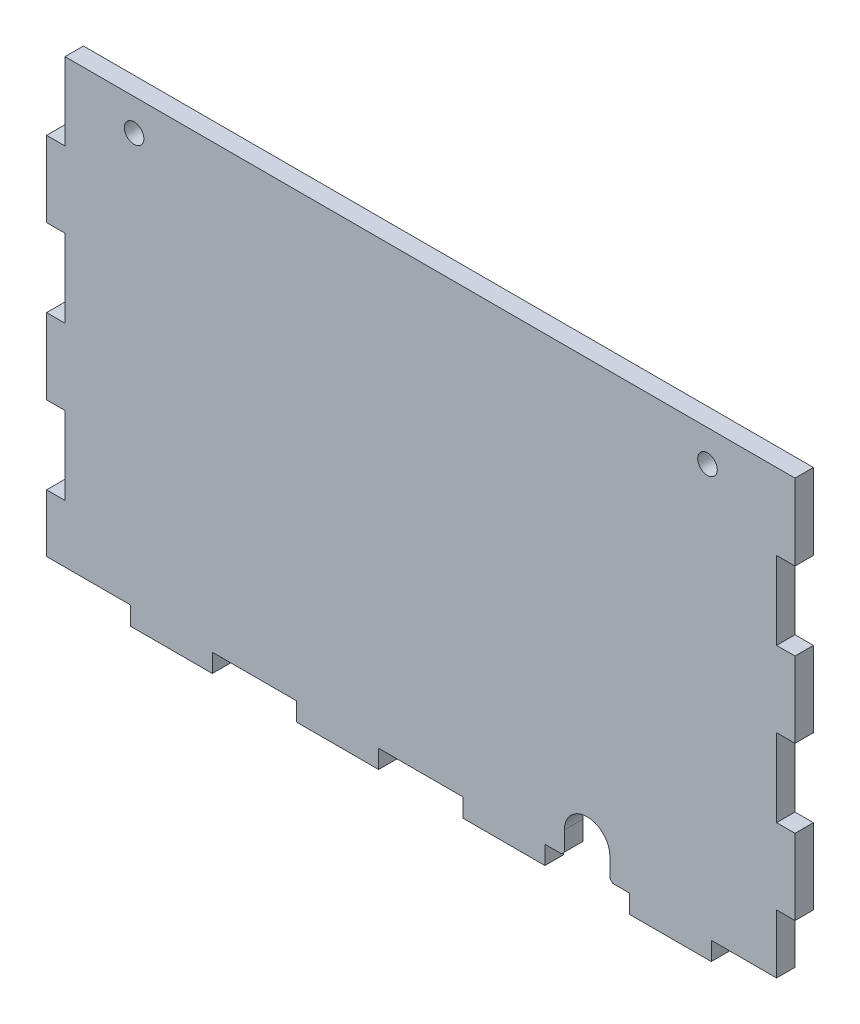
from build123d import *

# Parameters (mm, degrees)
SKETCH1_W             = 130
SKETCH1_H             = 80
BOSS_EXTRUDE1_DEPTH   = 3.2
SKETCH2_W             = 14.444444444
SKETCH2_H             = 3.2
SKETCH2_W_2           = 3.2
SKETCH2_H_2           = 13.333333334
SKETCH2_H_3           = 13.333333333
CUT_EXTRUDE1_DEPTH    = 153.676913775
CUT_EXTRUDE2_REACH    = 154.677
SKETCH3_R             = 1.7
CUT_EXTRUDE3_REACH    = 154.677
CHAMFER1_SIZE         = 0.5
WIDTH_TOLERANCE_BY    = 0.1
WIDTH_TOLERANCE_2_BY  = 0.1
WIDTH_TOLERANCE_3_BY  = 0.1
WIDTH_TOLERANCE_4_BY  = 0.1
WIDTH_TOLERANCE_5_BY  = 0.1
WIDTH_TOLERANCE_6_BY  = 0.1
WIDTH_TOLERANCE_7_BY  = 0.1
WIDTH_TOLERANCE_8_BY  = 0.1
WIDTH_TOLERANCE_9_BY  = 0.1
WIDTH_TOLERANCE_10_BY = 0.1
WIDTH_TOLERANCE_11_BY = 0.1
WIDTH_TOLERANCE_12_BY = 0.1
WIDTH_TOLERANCE_13_BY = 0.1
WIDTH_TOLERANCE_14_BY = 0.1
WIDTH_TOLERANCE_15_BY = 0.1
WIDTH_TOLERANCE_16_BY = 0.1
WIDTH_TOLERANCE_17_BY = 0.1
WIDTH_TOLERANCE_18_BY = 0.1


with BuildPart() as part:
    # Sketch1 → Boss-Extrude1 (new body)
    with BuildSketch(Plane.XY):
        with Locations((65, 40)):
            Rectangle(SKETCH1_W, SKETCH1_H)
    extrude(amount=BOSS_EXTRUDE1_DEPTH)

    # Sketch2 → Cut-Extrude1 (cut, through all)
    with BuildSketch(Plane.XY.offset(3.2)):
        with Locations((7.222222222, 1.6)):
            Rectangle(SKETCH2_W, SKETCH2_H)
        with Locations((36.111111111, 1.6)):
            Rectangle(SKETCH2_W, SKETCH2_H)
        with Locations((65, 1.6)):
            Rectangle(SKETCH2_W, SKETCH2_H)
        with Locations((93.888888889, 1.6)):
            Rectangle(SKETCH2_W, SKETCH2_H)
        Polygon((115.555555556, 0), (115.555555556, 3.2), (126.8, 3.2), (126.8, 13.333333333), (130, 13.333333333), (130, 0), align=None)
        with Locations((1.6, 20)):
            Rectangle(SKETCH2_W_2, SKETCH2_H_2)
        with Locations((1.6, 46.666666667)):
            Rectangle(SKETCH2_W_2, SKETCH2_H_3)
        with Locations((1.6, 73.333333334)):
            Rectangle(SKETCH2_W_2, SKETCH2_H_3)
        with Locations((128.4, 33.333333334)):
            Rectangle(SKETCH2_W_2, SKETCH2_H_3)
        with Locations((128.4, 60)):
            Rectangle(SKETCH2_W_2, SKETCH2_H_2)
    extrude(amount=-CUT_EXTRUDE1_DEPTH, mode=Mode.SUBTRACT)

    # Sketch3 → Cut-Extrude2 (cut, up to next)
    with BuildSketch(Plane.XY.offset(3.2), mode=Mode.PRIVATE) as cut_extrude2_sk1:
        with Locations((15.2, 74.5)):
            Circle(SKETCH3_R)
    cut_extrude2_tool1 = extrude(cut_extrude2_sk1.sketch, amount=-CUT_EXTRUDE2_REACH, mode=Mode.PRIVATE) & part.part
    # Sketch3 → Cut-Extrude2 (cut, up to next)
    with BuildSketch(Plane.XY.offset(3.2), mode=Mode.PRIVATE) as cut_extrude2_sk2:
        with Locations((114.8, 74.5)):
            Circle(SKETCH3_R)
    cut_extrude2_tool2 = extrude(cut_extrude2_sk2.sketch, amount=-CUT_EXTRUDE2_REACH, mode=Mode.PRIVATE) & part.part
    add(cut_extrude2_tool1.solids().sort_by_distance((15.2, 74.5, 3.2))[0], mode=Mode.SUBTRACT)
    add(cut_extrude2_tool2.solids().sort_by_distance((114.8, 74.5, 3.2))[0], mode=Mode.SUBTRACT)

    # Sketch4 → Cut-Extrude3 (cut, up to next)
    with BuildSketch(Plane(origin=(0, 0, 0), x_dir=(-1, 0, 0), z_dir=(0, 0, -1)), mode=Mode.PRIVATE) as cut_extrude3_sk1:
        with BuildLine():
            Line((-97.838888889, 3.2), (-97.838888889, 7.05))
            ThreePointArc((-97.838888889, 7.05), (-93.888888889, 11), (-89.938888889, 7.05))
            Line((-89.938888889, 7.05), (-89.938888889, 3.2))
            Line((-89.938888889, 3.2), (-97.838888889, 3.2))
        make_face()
    cut_extrude3_tool1 = extrude(cut_extrude3_sk1.sketch, amount=-CUT_EXTRUDE3_REACH, mode=Mode.PRIVATE) & part.part
    add(cut_extrude3_tool1.solids().sort_by_distance((93.888889, 6.732061, 0))[0], mode=Mode.SUBTRACT)

    # Chamfer1
    chamfer1_edges = [part.edges().sort_by_distance(p)[0] for p in [
        (89.938888889, 3.2, 1.6),
        (97.838888889, 3.2, 1.6),
    ]]
    chamfer(chamfer1_edges, length=CHAMFER1_SIZE)

    # Width tolerance: a face moved inward by 0.1
    extrude(part.faces().sort_by_distance((1.6, 53.333333333, 1.6))[0], amount=WIDTH_TOLERANCE_BY, dir=(0, 1, 0), mode=Mode.SUBTRACT)

    # Width tolerance 2: a face moved inward by 0.1
    extrude(part.faces().sort_by_distance((1.6, 26.666666667, 1.6))[0], amount=WIDTH_TOLERANCE_2_BY, dir=(0, 1, 0), mode=Mode.SUBTRACT)

    # Width tolerance 3: a face moved inward by 0.1
    extrude(part.faces().sort_by_distance((1.6, 13.333333333, 1.6))[0], amount=WIDTH_TOLERANCE_3_BY, dir=(0, -1, 0), mode=Mode.SUBTRACT)

    # Width tolerance 4: a face moved inward by 0.1
    extrude(part.faces().sort_by_distance((1.6, 40, 1.6))[0], amount=WIDTH_TOLERANCE_4_BY, dir=(0, -1, 0), mode=Mode.SUBTRACT)

    # Width tolerance 5: a face moved inward by 0.1
    extrude(part.faces().sort_by_distance((1.6, 66.666666667, 1.6))[0], amount=WIDTH_TOLERANCE_5_BY, dir=(0, -1, 0), mode=Mode.SUBTRACT)

    # Width tolerance 6: a face moved inward by 0.1
    extrude(part.faces().sort_by_distance((14.444444444, 1.6, 1.6))[0], amount=WIDTH_TOLERANCE_6_BY, dir=(1, 0, 0), mode=Mode.SUBTRACT)

    # Width tolerance 7: a face moved inward by 0.1
    extrude(part.faces().sort_by_distance((43.333333333, 1.6, 1.6))[0], amount=WIDTH_TOLERANCE_7_BY, dir=(1, 0, 0), mode=Mode.SUBTRACT)

    # Width tolerance 8: a face moved inward by 0.1
    extrude(part.faces().sort_by_distance((72.222222222, 1.6, 1.6))[0], amount=WIDTH_TOLERANCE_8_BY, dir=(1, 0, 0), mode=Mode.SUBTRACT)

    # Width tolerance 9: a face moved inward by 0.1
    extrude(part.faces().sort_by_distance((101.111111111, 1.6, 1.6))[0], amount=WIDTH_TOLERANCE_9_BY, dir=(1, 0, 0), mode=Mode.SUBTRACT)

    # Width tolerance 10: a face moved inward by 0.1
    extrude(part.faces().sort_by_distance((28.888888889, 1.6, 1.6))[0], amount=WIDTH_TOLERANCE_10_BY, dir=(-1, 0, 0), mode=Mode.SUBTRACT)

    # Width tolerance 11: a face moved inward by 0.1
    extrude(part.faces().sort_by_distance((57.777777778, 1.6, 1.6))[0], amount=WIDTH_TOLERANCE_11_BY, dir=(-1, 0, 0), mode=Mode.SUBTRACT)

    # Width tolerance 12: a face moved inward by 0.1
    extrude(part.faces().sort_by_distance((86.666666667, 1.6, 1.6))[0], amount=WIDTH_TOLERANCE_12_BY, dir=(-1, 0, 0), mode=Mode.SUBTRACT)

    # Width tolerance 13: a face moved inward by 0.1
    extrude(part.faces().sort_by_distance((115.555555556, 1.6, 1.6))[0], amount=WIDTH_TOLERANCE_13_BY, dir=(-1, 0, 0), mode=Mode.SUBTRACT)

    # Width tolerance 14: a face moved inward by 0.1
    extrude(part.faces().sort_by_distance((128.4, 13.333333333, 1.6))[0], amount=WIDTH_TOLERANCE_14_BY, dir=(0, 1, 0), mode=Mode.SUBTRACT)

    # Width tolerance 15: a face moved inward by 0.1
    extrude(part.faces().sort_by_distance((128.4, 66.666666667, 1.6))[0], amount=WIDTH_TOLERANCE_15_BY, dir=(0, 1, 0), mode=Mode.SUBTRACT)

    # Width tolerance 16: a face moved inward by 0.1
    extrude(part.faces().sort_by_distance((128.4, 40, 1.6))[0], amount=WIDTH_TOLERANCE_16_BY, dir=(0, 1, 0), mode=Mode.SUBTRACT)

    # Width tolerance 17: a face moved inward by 0.1
    extrude(part.faces().sort_by_distance((128.4, 26.666666667, 1.6))[0], amount=WIDTH_TOLERANCE_17_BY, dir=(0, -1, 0), mode=Mode.SUBTRACT)

    # Width tolerance 18: a face moved inward by 0.1
    extrude(part.faces().sort_by_distance((128.4, 53.333333333, 1.6))[0], amount=WIDTH_TOLERANCE_18_BY, dir=(0, -1, 0), mode=Mode.SUBTRACT)


solid = part.part
